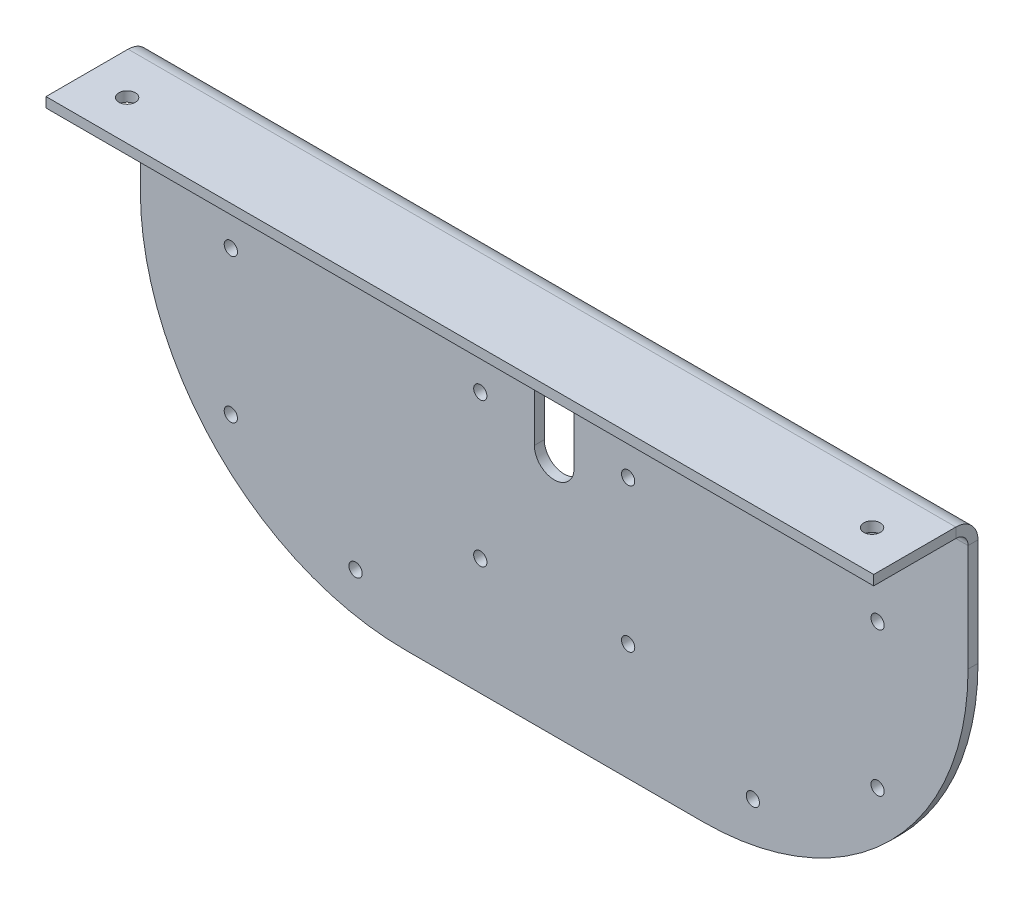
from build123d import *

# Parameters (mm, degrees)
BOSS_EXTRUDE1_DEPTH          = 125
SKETCH2_R                    = 2
CUT_EXTRUDE1_DEPTH           = 144.165114466
FILLET1_R                    = 80
SKETCH3_R                    = 2.5
CUT_EXTRUDE2_DEPTH           = 10
CUT_EXTRUDE3_DEPTH           = 10
BASE_FLANGE1_START           = -3
BASE_FLANGE1_DEPTH           = 3
EDGE_FLANGE1_STRIP_W         = 19.4
EDGE_FLANGE1_STRIP_H         = 3
EDGE_FLANGE1_STRIP_CUT_DEPTH = 250
EDGE_FLANGE1_DEPTH           = 250
SKETCH13_R                   = 2
CUT_EXTRUDE4_DEPTH           = 10
SKETCH14_R                   = 2.5
CUT_EXTRUDE5_DEPTH           = 10


# Read off the part's stored shape, not the designer's step: Base-Flange1
# Sheet-metal steps are written as plain solids
with BuildPart() as part:
    # Sketch1 → Boss-Extrude1 (new, symmetric)
    with BuildSketch(Plane(origin=(0, 0, 0), x_dir=(0, 0, -1), z_dir=(1, 0, 0))):
        with BuildLine():
            Line((-31, 61.5), (-6, 61.5))
            ThreePointArc((-6, 61.5), (-0.343145751, 59.156854249), (2, 53.5))
            Line((2, 53.5), (2, -53.5))
            Line((2, -53.5), (-2, -53.5))
            Line((-2, -53.5), (-2, 53.5))
            ThreePointArc((-2, 53.5), (-3.171572875, 56.328427125), (-6, 57.5))
            Line((-6, 57.5), (-31, 57.5))
            Line((-31, 57.5), (-31, 61.5))
        make_face()
    extrude(amount=BOSS_EXTRUDE1_DEPTH, both=True)

    # Sketch2 → Cut-Extrude1 (cut, through all)
    with BuildSketch(Plane(origin=(0, 0, -2), x_dir=(-1, 0, 0), z_dir=(0, 0, -1))):
        with Locations(Location((60, 47, 0), (0, 0, 90))):
            Circle(SKETCH2_R)
        with Locations(Location((97.672105065, 25.25, 0), (0, 0, 90))):
            Circle(SKETCH2_R)
        with Locations(Location((97.672105065, -18.25, 0), (0, 0, 90))):
            Circle(SKETCH2_R)
        with Locations(Location((60, -40, 0), (0, 0, 90))):
            Circle(SKETCH2_R)
        with Locations(Location((22.327894935, -18.25, 0), (0, 0, 90))):
            Circle(SKETCH2_R)
        with Locations(Location((22.327894935, 25.25, 0), (0, 0, 90))):
            Circle(SKETCH2_R)
        with Locations(Location((-22.327894935, 25.25, 0), (0, 0, 90))):
            Circle(SKETCH2_R)
        with Locations(Location((-22.327894935, -18.25, 0), (0, 0, 90))):
            Circle(SKETCH2_R)
        with Locations(Location((-60, -40, 0), (0, 0, 90))):
            Circle(SKETCH2_R)
        with Locations(Location((-97.672105065, -18.25, 0), (0, 0, 90))):
            Circle(SKETCH2_R)
        with Locations(Location((-97.672105065, 25.25, 0), (0, 0, 90))):
            Circle(SKETCH2_R)
        with Locations(Location((-60, 47, 0), (0, 0, 90))):
            Circle(SKETCH2_R)
    extrude(amount=-CUT_EXTRUDE1_DEPTH, mode=Mode.SUBTRACT)

    # Fillet1
    fillet1_edges = [part.edges().sort_by_distance(p)[0] for p in [
        (125, -53.5, 0),
        (-125, -53.5, 0),
    ]]
    fillet(fillet1_edges, radius=FILLET1_R)

    # Sketch3 → Cut-Extrude2 (cut)
    with BuildSketch(Plane(origin=(0, 61.5, 0), x_dir=(1, 0, 0), z_dir=(0, 1, 0))):
        with Locations(Location((-112.5, -18.5, 0), (0, 0, 270))):
            Circle(SKETCH3_R)
        with Locations(Location((112.5, -18.5, 0), (0, 0, 270))):
            Circle(SKETCH3_R)
    extrude(amount=-CUT_EXTRUDE2_DEPTH, mode=Mode.SUBTRACT)

    # Sketch4 → Cut-Extrude3 (cut)
    with BuildSketch(Plane(origin=(0, 0, -2), x_dir=(-1, 0, 0), z_dir=(0, 0, -1))):
        with BuildLine():
            Line((6, 40.5), (6, 19.5))
            ThreePointArc((6, 19.5), (0, 13.5), (-6, 19.5))
            Line((-6, 19.5), (-6, 40.5))
            ThreePointArc((-6, 40.5), (0, 46.5), (6, 40.5))
        make_face()
    extrude(amount=-CUT_EXTRUDE3_DEPTH, mode=Mode.SUBTRACT)


with BuildPart() as body_2:
    # Base-Flange1 outline → Base-Flange1 (new body)
    with BuildSketch(Plane(origin=(0, 0, -2), x_dir=(-1, 0, 0), z_dir=(0, 0, -1)).offset(BASE_FLANGE1_START)):
        with BuildLine():
            Line((125, 65.5), (-125, 65.5))
            Line((-125, 65.5), (-125, 26.5))
            ThreePointArc((-125, 26.5), (-101.568542495, -30.068542495), (-45, -53.5))
            Line((-45, -53.5), (45, -53.5))
            ThreePointArc((45, -53.5), (101.568542495, -30.068542495), (125, 26.5))
            Line((125, 26.5), (125, 65.5))
        make_face()
    extrude(amount=BASE_FLANGE1_DEPTH)

    # Edge-Flange1 strip (across the edge) → Edge-Flange1 strip cut (cut)
    with BuildSketch(Plane(origin=(125, 65.5, 1), x_dir=(0, -1, 0), z_dir=(-1, 0, 0))):
        with Locations((-3, -1.5)):
            Rectangle(EDGE_FLANGE1_STRIP_W, EDGE_FLANGE1_STRIP_H)
    extrude(amount=EDGE_FLANGE1_STRIP_CUT_DEPTH, mode=Mode.SUBTRACT)

    # Edge-Flange1 section (across the edge) → Edge-Flange1 (add)
    with BuildSketch(Plane(origin=(125, 65.5, 1), x_dir=(0, -1, 0), z_dir=(-1, 0, 0))):
        with BuildLine():
            Line((0, 3.7), (0, 28.5))
            Line((0, 28.5), (3, 28.5))
            Line((3, 28.5), (3, 3.7))
            ThreePointArc((3, 3.7), (4.08370491, 1.08370491), (6.7, 0))
            Line((6.7, 0), (6.7, -3))
            ThreePointArc((6.7, -3), (1.962384566, -1.037615434), (0, 3.7))
        make_face()
    extrude(amount=EDGE_FLANGE1_DEPTH)

    # Sketch13 → Cut-Extrude4 (cut)
    with BuildSketch(Plane(origin=(0, 0, -2), x_dir=(-1, 0, 0), z_dir=(0, 0, -1))):
        with Locations(Location((97.672105065, -18.25, 0), (0, 0, 90))):
            Circle(SKETCH13_R)
        with Locations(Location((97.672105065, 25.25, 0), (0, 0, 90))):
            Circle(SKETCH13_R)
        with Locations(Location((60, 47, 0), (0, 0, 90))):
            Circle(SKETCH13_R)
        with Locations(Location((-97.672105065, -18.25, 0), (0, 0, 90))):
            Circle(SKETCH13_R)
        with Locations(Location((-60, -40, 0), (0, 0, 90))):
            Circle(SKETCH13_R)
        with Locations(Location((-22.327894935, -18.25, 0), (0, 0, 90))):
            Circle(SKETCH13_R)
        with Locations(Location((-22.327894935, 25.25, 0), (0, 0, 90))):
            Circle(SKETCH13_R)
        with Locations(Location((22.327894935, 25.25, 0), (0, 0, 90))):
            Circle(SKETCH13_R)
        with Locations(Location((22.327894935, -18.25, 0), (0, 0, 90))):
            Circle(SKETCH13_R)
        with Locations(Location((60, -40, 0), (0, 0, 90))):
            Circle(SKETCH13_R)
        with Locations(Location((-60, 47, 0), (0, 0, 90))):
            Circle(SKETCH13_R)
        with Locations(Location((-97.672105065, 25.25, 0), (0, 0, 90))):
            Circle(SKETCH13_R)
        with BuildLine():
            Line((6, 19.5), (6, 40.5))
            ThreePointArc((6, 40.5), (0, 46.5), (-6, 40.5))
            Line((-6, 40.5), (-6, 19.5))
            ThreePointArc((-6, 19.5), (0, 13.5), (6, 19.5))
        make_face()
    extrude(amount=-CUT_EXTRUDE4_DEPTH, mode=Mode.SUBTRACT)

    # Sketch14 → Cut-Extrude5 (cut)
    with BuildSketch(Plane(origin=(0, 65.5, 0), x_dir=(1, 0, 0), z_dir=(0, 1, 0))):
        with Locations(Location((-112.5, -17.5, 0), (0, 0, 270))):
            Circle(SKETCH14_R)
        with Locations(Location((112.5, -17.5, 0), (0, 0, 270))):
            Circle(SKETCH14_R)
    extrude(amount=-CUT_EXTRUDE5_DEPTH, mode=Mode.SUBTRACT)


solid = body_2.part
